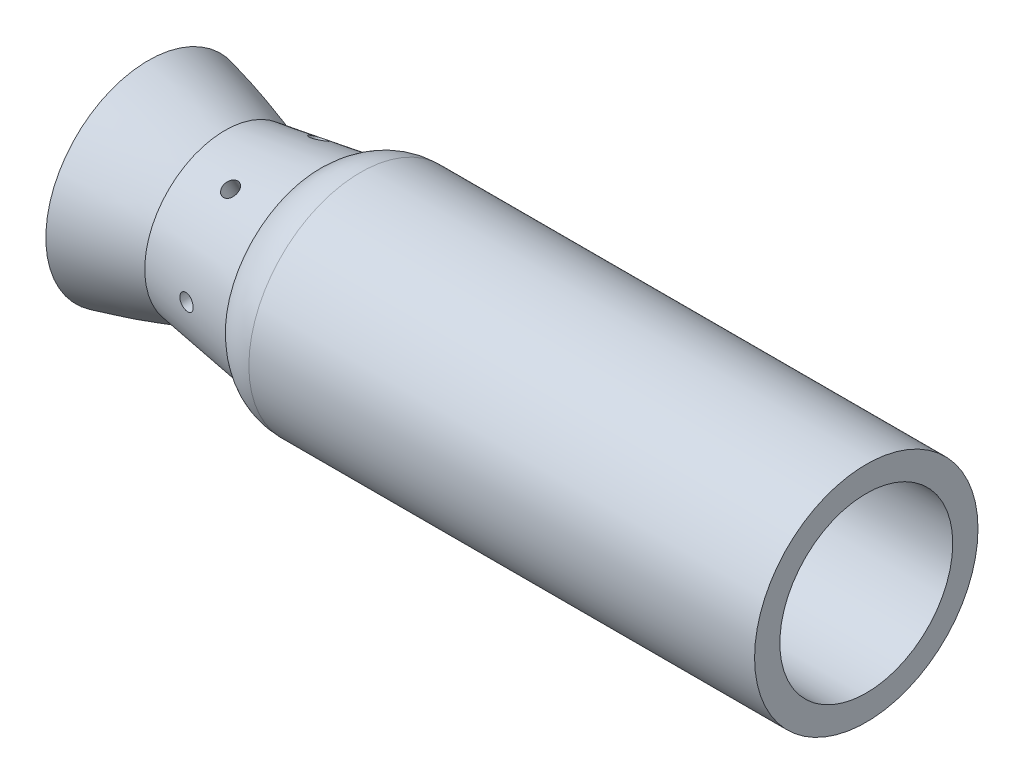
from build123d import *

# Parameters (mm, degrees)
SKETCH2_R          = 2.5
CUT_EXTRUDE2_DEPTH = 20
CIRPATTERN1_COUNT  = 6


with BuildPart() as part:
    # Sketch1 → Revolve1 (revolve)
    with BuildSketch(Plane.XY):
        with BuildLine():
            Line((28.949236933, 27.386004017), (189.133015331, 27.386004017))
            Line((189.133015331, 27.386004017), (189.133015331, 35.386004017))
            Line((189.133015331, 35.386004017), (28.949236933, 35.386004017))
            ThreePointArc((28.949236933, 35.386004017), (22.060935151, 34.015835602), (16.221314872, 30.113926078))
            Line((16.221314872, 30.113926078), (-13.981586934, 25.437652311))
            add(Edge.make_bspline(
                [(-13.981586934, 25.437652311), (-16.029314719, 26.139512712), (-28.160190772, 30.070121673), (-38.315022829, 32.432092239)],
                knots=[0.414468937, 0.414468937, 0.414468937, 0.513462719, 1, 1, 1], degree=2))
            Line((-38.315022829, 32.432092239), (-40.127010283, 24.64))
            add(Edge.make_bspline(
                [(0, 11.536137468), (-19.948257354, 19.947595697), (-40.127010283, 24.64)],
                knots=[0, 0, 0, 1, 1, 1], degree=2))
            ThreePointArc((0, 11.536137468), (0.81433228, 11.284876268), (1.662309445, 11.2))
            ThreePointArc((1.662309445, 11.2), (8.091391109, 12.478823854), (13.541703369, 16.120606076))
            Line((13.541703369, 16.120606076), (21.878169121, 24.457071829))
            ThreePointArc((21.878169121, 24.457071829), (25.12240261, 26.624799342), (28.949236933, 27.386004017))
        make_face()
    revolve(axis=Axis((0, 0, 0), (-1, 0, 0)))

    # Sketch2 → Cut-Extrude2 (cut)
    with BuildSketch(Plane.XY.offset(40)):
        with Locations((1.662309445, 0)):
            Circle(SKETCH2_R)
    cut_extrude2 = extrude(amount=-CUT_EXTRUDE2_DEPTH, mode=Mode.SUBTRACT)

    # CirPattern1: Cut-Extrude2 ×6 about axis
    cirpattern1_axis = Axis((0, 0, 0), (-1, 0, 0))
    for i in range(1, CIRPATTERN1_COUNT):
        add(cut_extrude2.rotate(cirpattern1_axis, i * 360 / CIRPATTERN1_COUNT), mode=Mode.SUBTRACT)


solid = part.part
